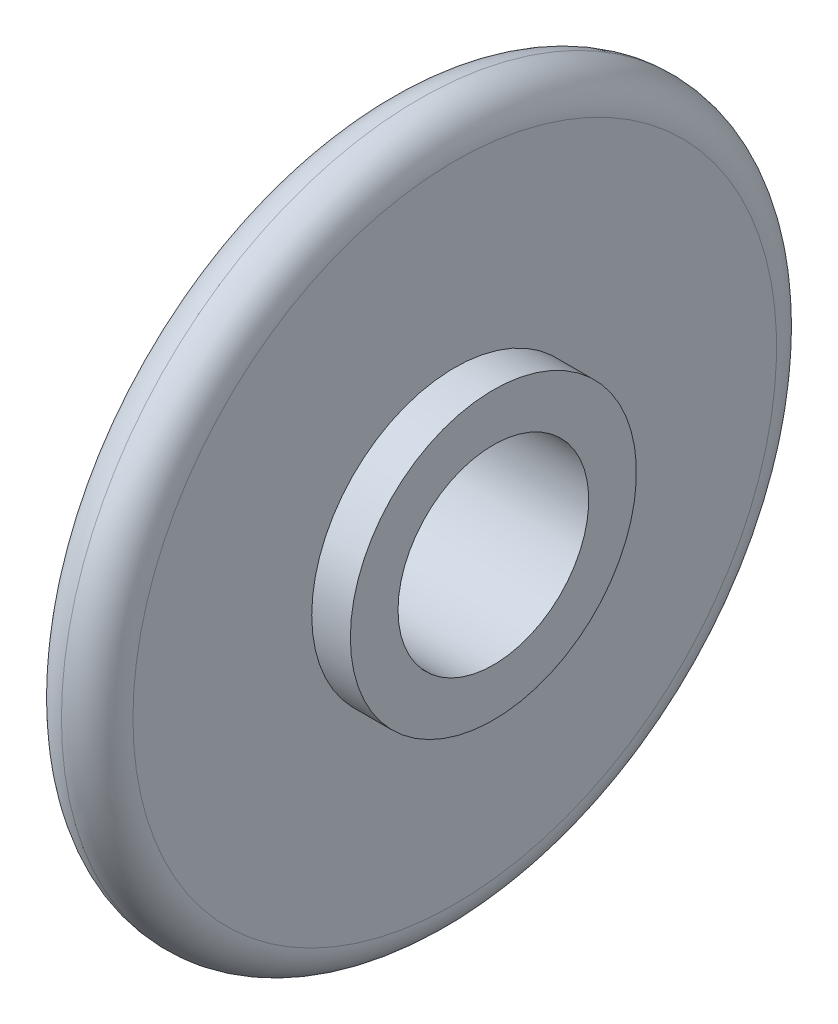
from build123d import *

# Parameters (mm, degrees)
FILLET_1_R = 1.5


with BuildPart() as part:
    # 草图1 → 旋转2 (revolve)
    with BuildSketch(Plane.XY, mode=Mode.PRIVATE) as revolve_2_sk:
        Polygon((-12.155060406, 4), (-5.915060406, 4), (-5.915060406, 6), (-7.535060406, 6), (-7.535060406, 15), (-10.535060406, 15), (-10.535060406, 6), (-12.155060406, 6), align=None)
    revolve(revolve_2_sk.sketch.rotate(Axis((-24.331674281, 0, 0), (1, 0, 0)), 90), axis=Axis((-24.331674281, 0, 0), (1, 0, 0)))

    # 圆角1
    fillet_1_edges = [part.edges().sort_by_distance(p)[0] for p in [
        (-10.535060406, 0, -15),
        (-7.535060406, 0, -15),
    ]]
    fillet(fillet_1_edges, radius=FILLET_1_R - 0.0001)  # a hair under: the kernel refuses the full size


solid = part.part
